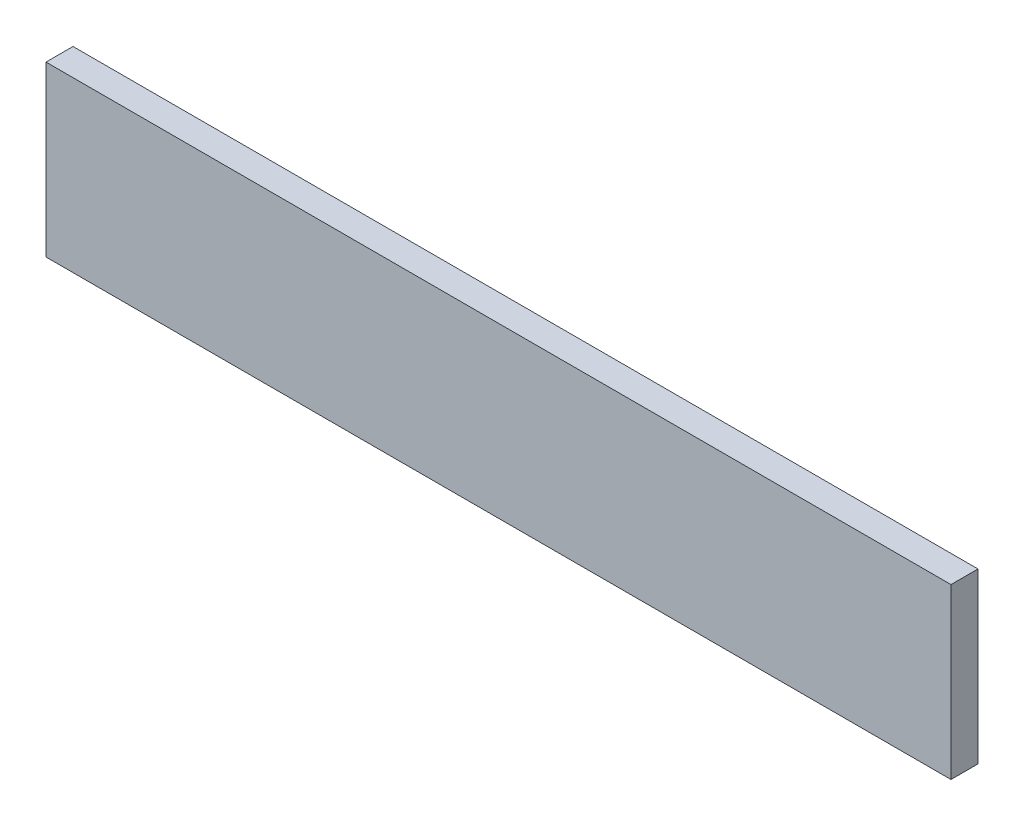
from build123d import *

# Parameters (mm, degrees)
SKETCH1_W           = 638.1
SKETCH1_H           = 119.05
BOSS_EXTRUDE1_DEPTH = 19.05


with BuildPart() as part:
    # Sketch1 → Boss-Extrude1 (new body)
    with BuildSketch(Plane.XY):
        with Locations((-319.05, 59.525)):
            Rectangle(SKETCH1_W, SKETCH1_H)
    extrude(amount=BOSS_EXTRUDE1_DEPTH)


solid = part.part
